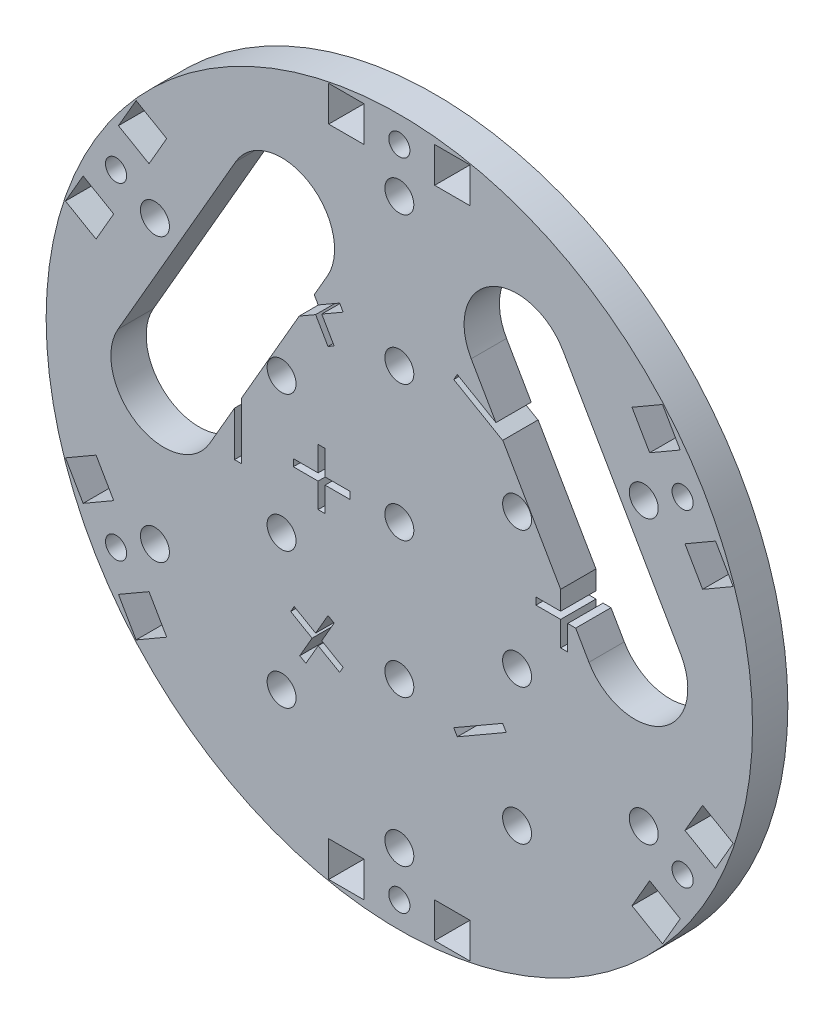
from build123d import *

# Parameters (mm, degrees)
BOSS_EXTRU_1_OUTLINE_R   = 50
BOSS_EXTRU_1_OUTLINE_W   = 5
BOSS_EXTRU_1_OUTLINE_H   = 5
BOSS_EXTRU_1_OUTLINE_R_2 = 2.05
BOSS_EXTRU_1_OUTLINE_R_3 = 1.5
BOSS_EXTRU_1_DEPTH       = 5
SKETCH3_W                = 1
SKETCH3_H                = 8
CUT_EXTRUDE2_DEPTH       = 10
CUT_EXTRUDE3_DEPTH       = 10


# Read off the part's stored shape, not the designer's step: Boss.-Extru.1
with BuildPart() as part:
    # Boss.-Extru.1 outline → Boss.-Extru.1 (new body)
    with BuildSketch(Plane.XY):
        Circle(BOSS_EXTRU_1_OUTLINE_R)
        Polygon((-37.262039705, -33.060254038), (-39.762039705, -28.730127019), (-35.431912686, -26.230127019), (-32.931912686, -30.560254038), align=None, mode=Mode.SUBTRACT)
        with Locations((-7.5, -46.3)):
            Rectangle(BOSS_EXTRU_1_OUTLINE_W, BOSS_EXTRU_1_OUTLINE_H, mode=Mode.SUBTRACT)
        with Locations((-16.666666667, -28.867513459)):
            Circle(BOSS_EXTRU_1_OUTLINE_R_2, mode=Mode.SUBTRACT)
        with Locations((-40.096976195, -23.15)):
            Circle(BOSS_EXTRU_1_OUTLINE_R_3, mode=Mode.SUBTRACT)
        Polygon((-42.931912686, -13.239745962), (-40.431912686, -17.569872981), (-44.762039705, -20.069872981), (-47.262039705, -15.739745962), align=None, mode=Mode.SUBTRACT)
        with Locations((-34.597845014, -19.975075132)):
            Circle(BOSS_EXTRU_1_OUTLINE_R_2, mode=Mode.SUBTRACT)
        with Locations((-16.671397033, -9.625235564)):
            Circle(BOSS_EXTRU_1_OUTLINE_R_2, mode=Mode.SUBTRACT)
        with Locations((0, -46.3)):
            Circle(BOSS_EXTRU_1_OUTLINE_R_3, mode=Mode.SUBTRACT)
        with Locations((7.5, -46.3)):
            Rectangle(BOSS_EXTRU_1_OUTLINE_W, BOSS_EXTRU_1_OUTLINE_H, mode=Mode.SUBTRACT)
        with Locations((0, -39.950150265)):
            Circle(BOSS_EXTRU_1_OUTLINE_R_2, mode=Mode.SUBTRACT)
        with Locations((16.666666667, -28.867513459)):
            Circle(BOSS_EXTRU_1_OUTLINE_R_2, mode=Mode.SUBTRACT)
        Polygon((32.931912686, -30.560254038), (35.431912686, -26.230127019), (39.762039705, -28.730127019), (37.262039705, -33.060254038), align=None, mode=Mode.SUBTRACT)
        with Locations((0, -19.232757636)):
            Circle(BOSS_EXTRU_1_OUTLINE_R_2, mode=Mode.SUBTRACT)
        with Locations((16.666666667, -9.622504487)):
            Circle(BOSS_EXTRU_1_OUTLINE_R_2, mode=Mode.SUBTRACT)
        with Locations((34.597845014, -19.975075132)):
            Circle(BOSS_EXTRU_1_OUTLINE_R_2, mode=Mode.SUBTRACT)
        with Locations((40.096976195, -23.15)):
            Circle(BOSS_EXTRU_1_OUTLINE_R_3, mode=Mode.SUBTRACT)
        Polygon((47.262039705, -15.739745962), (44.762039705, -20.069872981), (40.431912686, -17.569872981), (42.931912686, -13.239745962), align=None, mode=Mode.SUBTRACT)
        with Locations((-33.333333333, 0)):
            Circle(BOSS_EXTRU_1_OUTLINE_R_2, mode=Mode.SUBTRACT)
        Polygon((-47.262039705, 15.739745962), (-44.762039705, 20.069872981), (-40.431912686, 17.569872981), (-42.931912686, 13.239745962), align=None, mode=Mode.SUBTRACT)
        with Locations((-40.096976195, 23.15)):
            Circle(BOSS_EXTRU_1_OUTLINE_R_3, mode=Mode.SUBTRACT)
        with Locations((-34.597845014, 19.975075132)):
            Circle(BOSS_EXTRU_1_OUTLINE_R_2, mode=Mode.SUBTRACT)
        with Locations((-16.671397032, 9.625235564)):
            Circle(BOSS_EXTRU_1_OUTLINE_R_2, mode=Mode.SUBTRACT)
        Polygon((-32.931912686, 30.560254038), (-35.431912686, 26.230127019), (-39.762039705, 28.730127019), (-37.262039705, 33.060254038), align=None, mode=Mode.SUBTRACT)
        with Locations((-16.666666667, 28.867513459)):
            Circle(BOSS_EXTRU_1_OUTLINE_R_2, mode=Mode.SUBTRACT)
        with Locations((-7.5, 46.3)):
            Rectangle(BOSS_EXTRU_1_OUTLINE_W, BOSS_EXTRU_1_OUTLINE_H, mode=Mode.SUBTRACT)
        Circle(BOSS_EXTRU_1_OUTLINE_R_2, mode=Mode.SUBTRACT)
        with Locations((16.669571796, 9.624181764)):
            Circle(BOSS_EXTRU_1_OUTLINE_R_2, mode=Mode.SUBTRACT)
        with Locations((0, 19.165334425)):
            Circle(BOSS_EXTRU_1_OUTLINE_R_2, mode=Mode.SUBTRACT)
        with Locations((33.333333333, 0)):
            Circle(BOSS_EXTRU_1_OUTLINE_R_2, mode=Mode.SUBTRACT)
        with Locations((34.597845014, 19.975075133)):
            Circle(BOSS_EXTRU_1_OUTLINE_R_2, mode=Mode.SUBTRACT)
        Polygon((42.931912686, 13.239745962), (40.431912686, 17.569872981), (44.762039705, 20.069872981), (47.262039705, 15.739745962), align=None, mode=Mode.SUBTRACT)
        with Locations((40.096976195, 23.15)):
            Circle(BOSS_EXTRU_1_OUTLINE_R_3, mode=Mode.SUBTRACT)
        with Locations((16.666666667, 28.867513459)):
            Circle(BOSS_EXTRU_1_OUTLINE_R_2, mode=Mode.SUBTRACT)
        with Locations((0, 39.950150265)):
            Circle(BOSS_EXTRU_1_OUTLINE_R_2, mode=Mode.SUBTRACT)
        with Locations((0, 46.3)):
            Circle(BOSS_EXTRU_1_OUTLINE_R_3, mode=Mode.SUBTRACT)
        with Locations((7.5, 46.3)):
            Rectangle(BOSS_EXTRU_1_OUTLINE_W, BOSS_EXTRU_1_OUTLINE_H, mode=Mode.SUBTRACT)
        Polygon((37.262039705, 33.060254038), (39.762039705, 28.730127019), (35.431912686, 26.230127019), (32.931912686, 30.560254038), align=None, mode=Mode.SUBTRACT)
    extrude(amount=BOSS_EXTRU_1_DEPTH)

    # Sketch3 → Cut-Extrude2 (cut)
    with BuildSketch(Plane.XY.offset(5)):
        with Locations((-22.833333333, 0)):
            Rectangle(SKETCH3_W, SKETCH3_H)
        Polygon((-13.233653965, 23.921361037), (-14.099679369, 23.421361037), (-12.349679369, 20.390272124), (-15.380768282, 18.640272124), (-14.880768282, 17.77424672), (-11.849679369, 19.52424672), (-10.099679369, 16.493157806), (-9.233653965, 16.993157806), (-10.983653965, 20.02424672), (-7.952565052, 21.77424672), (-8.452565052, 22.640272124), (-11.483653965, 20.890272124), align=None)
        Polygon((15.130768282, 18.207259422), (14.630768282, 17.341234018), (7.702565052, 21.341234018), (8.202565052, 22.207259422), align=None)
        Polygon((8.202565052, -22.207259422), (7.702565052, -21.341234018), (14.630768282, -17.341234018), (15.130768282, -18.207259422), align=None)
        Polygon((27.333333333, -0.5), (27.333333333, 0.5), (23.833333333, 0.5), (23.833333333, 4), (22.833333333, 4), (22.833333333, 0.5), (19.333333333, 0.5), (19.333333333, -0.5), (22.833333333, -0.5), (22.833333333, -4), (23.833333333, -4), (23.833333333, -0.5), align=None)
        Polygon((-14.099679369, -23.421361037), (-13.233653965, -23.921361037), (-11.483653965, -20.890272124), (-8.452565052, -22.640272124), (-7.952565052, -21.77424672), (-10.983653965, -20.02424672), (-9.233653965, -16.993157806), (-10.099679369, -16.493157806), (-11.849679369, -19.52424672), (-14.880768282, -17.77424672), (-15.380768282, -18.640272124), (-12.349679369, -20.390272124), align=None)
        Polygon((-7.005935602, -0.708643072), (-7.005935602, 0.291356928), (-10.505935602, 0.291356928), (-10.505935602, 3.791356928), (-11.505935602, 3.791356928), (-11.505935602, 0.291356928), (-15.005935602, 0.291356928), (-15.005935602, -0.708643072), (-11.505935602, -0.708643072), (-11.505935602, -4.208643072), (-10.505935602, -4.208643072), (-10.505935602, -0.708643072), align=None)
        Polygon((-20.645633013, 13.413868493), (-21.300480769, 12.280855673), (-21.552183494, 12.425987884), (-20.897335737, 13.559000705), align=None)
    extrude(amount=-CUT_EXTRUDE2_DEPTH, mode=Mode.SUBTRACT)

    # Sketch4 → Cut-Extrude3 (cut)
    with BuildSketch(Plane(origin=(0, 0, 0), x_dir=(-1, 0, 0), z_dir=(0, 0, -1))):
        with BuildLine():
            Line((26.838142805, -3.75), (10.171476138, 25.117513459))
            ThreePointArc((10.171476138, 25.117513459), (12.916666667, 35.362703988), (23.161857195, 32.617513459))
            Line((23.161857195, 32.617513459), (39.828523862, 3.75))
            ThreePointArc((39.828523862, 3.75), (37.083333333, -6.495190528), (26.838142805, -3.75))
        make_face()
        with BuildLine():
            Line((-10.171476138, 25.117513459), (-26.838142805, -3.75))
            ThreePointArc((-26.838142805, -3.75), (-37.083333333, -6.495190528), (-39.828523862, 3.75))
            Line((-39.828523862, 3.75), (-23.161857195, 32.617513459))
            ThreePointArc((-23.161857195, 32.617513459), (-12.916666667, 35.362703988), (-10.171476138, 25.117513459))
        make_face()
    extrude(amount=-CUT_EXTRUDE3_DEPTH, mode=Mode.SUBTRACT)


with BuildPart() as body_2:
    # of the pieces the cut leaves, the one that is kept (cut_extrude3_keep)
    add(part.part.solids().sort_by_distance((50, 0, 0))[0])


solid = body_2.part
